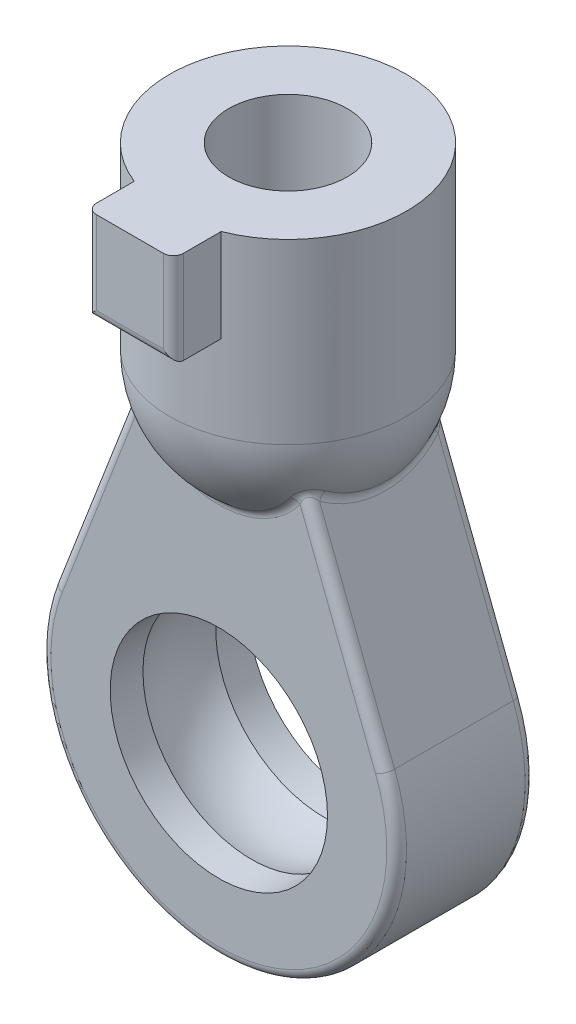
from build123d import *

# Parameters (mm, degrees)
BOSS_EXTRUDE1_DEPTH = 1.75
SKETCH6_W           = 2.2
SKETCH6_H           = 2.35
BOSS_EXTRUDE2_DEPTH = 4
SKETCH4_R           = 1.5
CUT_EXTRUDE1_DEPTH  = 4.5
SKETCH7_R           = 2.75
CUT_EXTRUDE2_DEPTH  = 15.10895106
FILLET1_R           = 0.25


with BuildPart() as part:
    # Sketch1 → Boss-Extrude1 (new, symmetric)
    with BuildSketch(Plane.XY):
        with BuildLine():
            Line((0, 12.5), (4.198285364, 1.62))
            ThreePointArc((4.198285364, 1.62), (0, -4.5), (-4.198285364, 1.62))
            Line((-4.198285364, 1.62), (0, 12.5))
        make_face()
    extrude(amount=BOSS_EXTRUDE1_DEPTH, both=True)

    # Sketch2 → Cut-Revolve1 (revolve, cut)
    with BuildSketch(Plane.XY):
        with BuildLine():
            Line((0, 2.9), (0, -2.9))
            ThreePointArc((0, -2.9), (2.9, 0), (0, 2.9))
        make_face()
    revolve(axis=Axis((0, -5.502171276, 0), (0, 1, 0)), mode=Mode.SUBTRACT)

    # Sketch3 → Revolve2 (revolve)
    with BuildSketch(Plane.XY):
        with BuildLine():
            Line((0, 12.5), (3, 12.5))
            Line((3, 12.5), (3, 8))
            ThreePointArc((3, 8), (2.121320344, 5.878679656), (0, 5))
            Line((0, 5), (0, 12.5))
        make_face()
    revolve(axis=Axis((0, 0, 0), (0, 1, 0)))

    # Sketch6 → Boss-Extrude2 (add)
    with BuildSketch(Plane.XY):
        with Locations((0, 11.325)):
            Rectangle(SKETCH6_W, SKETCH6_H)
    extrude(amount=BOSS_EXTRUDE2_DEPTH)

    # Sketch4 → Cut-Extrude1 (cut)
    with BuildSketch(Plane(origin=(0, 12.5, 0), x_dir=(1, 0, 0), z_dir=(0, 1, 0))):
        Circle(SKETCH4_R)
    extrude(amount=-CUT_EXTRUDE1_DEPTH, mode=Mode.SUBTRACT)

    # Sketch7 → Cut-Extrude2 (cut, through all)
    with BuildSketch(Plane.XY.offset(1.75)):
        Circle(SKETCH7_R)
    extrude(amount=-CUT_EXTRUDE2_DEPTH, mode=Mode.SUBTRACT)

    # Fillet1
    fillet1_edges = [part.edges().sort_by_distance(p)[0] for p in [
        (-3.182468661, 4.252523702, -1.75),
        (0, -4.5, -1.75),
        (-3.182468661, 4.252523702, 1.75),
        (0, -4.5, 1.75),
        (-1.1, 11.325, 4),
        (0, 10.15, 4),
        (1.1, 11.325, 4),
        (0, 5.563301414, -1.75),
        (-2.420380949, 6.227500053, 0),
        (0, 5.563301414, 1.75),
        (2.35456608, 6.398061535, -0.943298325),
        (3.182468661, 4.252523702, -1.75),
        (3.182468661, 4.252523702, 1.75),
    ]]
    fillet(fillet1_edges, radius=FILLET1_R)


solid = part.part
